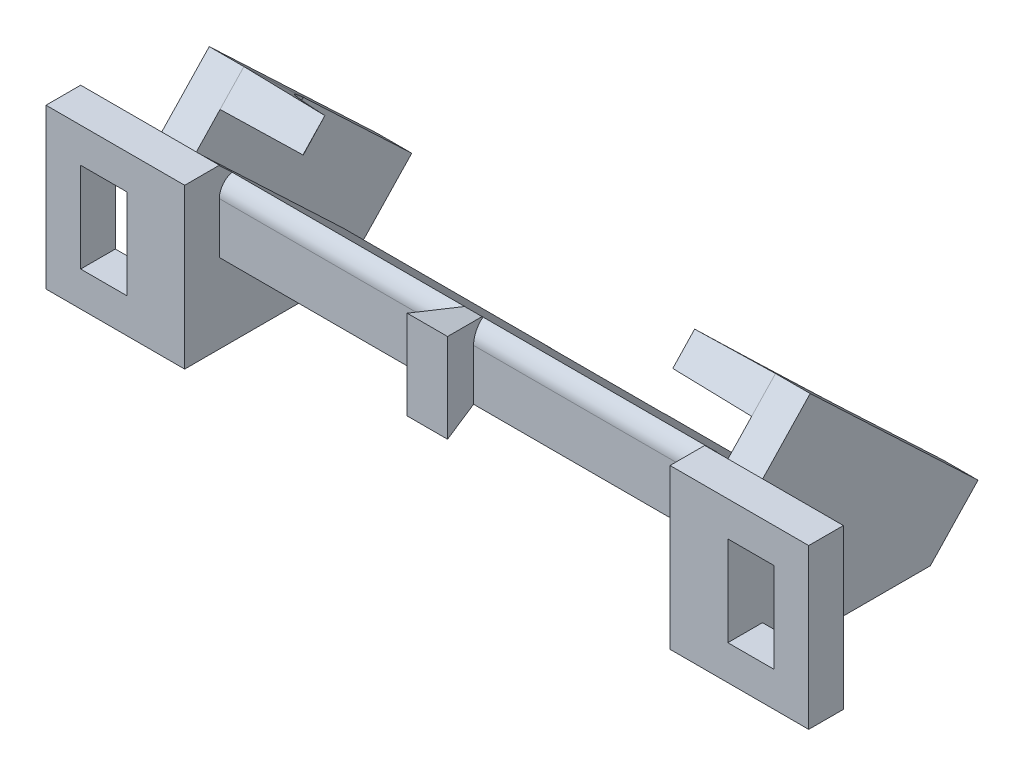
from build123d import *

# Parameters (mm, degrees)
BOSS_EXTRUDE2_DEPTH     = 26
SHELL3_T                = -5
SKETCH2_W               = 3
SKETCH2_H               = 20
BOSS_EXTRUDE3_DEPTH     = 6
BOSS_EXTRUDE4_DEPTH     = 7
BOSS_EXTRUDE4_TAPER     = 1
BOSS_EXTRUDE5_START     = -7.07
BOSS_EXTRUDE5_OUTLINE_W = 12
BOSS_EXTRUDE5_OUTLINE_H = 3
BOSS_EXTRUDE5_DEPTH     = 13.778752476
SKETCH7_W               = 4
SKETCH7_H               = 7.778752476
CUT_EXTRUDE1_DEPTH      = 3
CUT_EXTRUDE5_DEPTH      = 3
SKETCH8_W               = 2
SKETCH8_H               = 6.204571956
BOSS_EXTRUDE6_DEPTH     = 3
BOSS_EXTRUDE6_DRAFT     = -14
SKETCH10_W              = 10
SKETCH10_H              = 3
CUT_EXTRUDE2_DEPTH      = 3
CHAMFER2_SIZE           = 1.5
CHAMFER2_SIZE_2         = 1.061054559
FILLET7_R               = 1.5


# Read off the part's stored shape, not the designer's step: Boss-Extrude5
with BuildPart() as part:
    # Sketch1 → Boss-Extrude2 (new, symmetric)
    with BuildSketch(Plane(origin=(0, 0, 0), x_dir=(0, 0, -1), z_dir=(1, 0, 0))):
        Polygon((-7.07, 6.681327836), (-7.07, -7.07), (7.452430332, -7.07), align=None)
    extrude(amount=BOSS_EXTRUDE2_DEPTH, both=True)

    # Shell3
    shell3_openings = [part.faces().sort_by_distance(p)[0] for p in [
        (0, -0.194336082, 7.07),
        (0, -7.07, -0.191215166),
    ]]
    offset(amount=SHELL3_T, openings=shell3_openings, kind=Kind.INTERSECTION)

    # Sketch2 → Boss-Extrude3 (add)
    with BuildSketch(Plane(origin=(0, -0.006998714, 0.006627101), x_dir=(1, 0, 0), z_dir=(0, 0.7261215165867746, -0.6875663918122543))):
        with Locations((-24.5, 0.272464405)):
            Rectangle(SKETCH2_W, SKETCH2_H)
    boss_extrude3 = extrude(amount=BOSS_EXTRUDE3_DEPTH)

    # Sketch3 → Boss-Extrude4 (add)
    with BuildSketch(Plane(origin=(-23, 0, 0), x_dir=(0, 0, -1), z_dir=(1, 0, 0))):
        Polygon((-5.007300825, 8.859692386), (0.075549792, 4.046727643), (2.138248967, 6.225092193), (-2.944601649, 11.038056936), align=None)
    boss_extrude4 = extrude(amount=BOSS_EXTRUDE4_DEPTH, taper=BOSS_EXTRUDE4_TAPER)

    # Boss-Extrude5 outline → Boss-Extrude5 (add)
    with BuildSketch(Plane(origin=(0, 0, 0), x_dir=(1, 0, 0), z_dir=(0, 1, 0)).offset(BOSS_EXTRUDE5_START)):
        with Locations((-27, -8.57)):
            Rectangle(BOSS_EXTRUDE5_OUTLINE_W, BOSS_EXTRUDE5_OUTLINE_H)
    boss_extrude5 = extrude(amount=BOSS_EXTRUDE5_DEPTH)

    # Sketch7 → Cut-Extrude1 (cut)
    with BuildSketch(Plane(origin=(0, 0, 7.07), x_dir=(-1, 0, 0), z_dir=(0, 0, -1))):
        with Locations((28, -0.180623762)):
            Rectangle(SKETCH7_W, SKETCH7_H)
    cut_extrude1 = extrude(amount=-CUT_EXTRUDE1_DEPTH, mode=Mode.SUBTRACT)

    # Sketch11 → Cut-Extrude5 (cut)
    with BuildSketch(Plane(origin=(0.097524812, 4.056980848, -3.841565936), x_dir=(0.9998476951563913, -0.012672567830329124, 0.011999688122524015), z_dir=(0.017452406437283557, 0.72601092476275, -0.6874616721204788))):
        with BuildLine():
            ThreePointArc((-16.099976916, -9.605350141), (-20.470201884, -7.075920319), (-23.038834329, -2.72862129))
            add(Edge.make_bspline(
                [(-23.038834329, -2.72862129), (-20.964785252, -1.12213519), (-16.845095332, -0.866613762), (-13.311050846, -5.432002143), (-14.677947992, -8.654526842), (-16.099976916, -9.605350141)],
                knots=[0, 0, 0, 0, 0.462245197, 0.666716807, 1, 1, 1, 1], degree=3))
        make_face()
    cut_extrude5 = extrude(amount=-CUT_EXTRUDE5_DEPTH, mode=Mode.SUBTRACT)

    # Mirror4: Boss-Extrude3, Boss-Extrude4, Boss-Extrude5, Cut-Extrude1, Cut-Extrude5 across plane
    add(boss_extrude3.mirror(Plane(origin=(0, 0, 0), x_dir=(0, 0, 1), z_dir=(1, 0, 0))))
    add(boss_extrude4.mirror(Plane(origin=(0, 0, 0), x_dir=(0, 0, 1), z_dir=(1, 0, 0))))
    add(boss_extrude5.mirror(Plane(origin=(0, 0, 0), x_dir=(0, 0, 1), z_dir=(1, 0, 0))))
    add(cut_extrude1.mirror(Plane(origin=(0, 0, 0), x_dir=(0, 0, 1), z_dir=(1, 0, 0))), mode=Mode.SUBTRACT)
    add(cut_extrude5.mirror(Plane(origin=(0, 0, 0), x_dir=(0, 0, 1), z_dir=(1, 0, 0))), mode=Mode.SUBTRACT)


with BuildPart() as boss_extrude6_tool:
    # Sketch8 → Boss-Extrude6 (with draft: the straight prism first)
    with BuildSketch(Plane.XY.offset(7.07)):
        with Locations((0, 2.897714022)):
            Rectangle(SKETCH8_W, SKETCH8_H)
    extrude(amount=BOSS_EXTRUDE6_DEPTH)
    # Boss-Extrude6: the draft: its side faces are tilted about the plane it starts from
    boss_extrude6_sides = [boss_extrude6_tool.faces().sort_by_distance(p)[0] for p in [
        (0, -0.204571956, 8.57),
        (1, 2.897714022, 8.57),
        (0, 6, 8.57),
        (-1, 2.897714022, 8.57),
    ]]
    draft(boss_extrude6_sides, Plane.XY.offset(7.07), BOSS_EXTRUDE6_DRAFT)


with BuildPart() as part_1:
    add(part.part)

    # Boss-Extrude6: add boss_extrude6_tool
    add(boss_extrude6_tool.part)

    # Sketch10 → Cut-Extrude2 (cut)
    with BuildSketch(Plane(origin=(0, -0.006998714, 0.006627101), x_dir=(1, 0, 0), z_dir=(0, 0.7261215165867746, -0.6875663918122543))):
        with Locations((0, 8.772464405)):
            Rectangle(SKETCH10_W, SKETCH10_H)
    extrude(amount=-CUT_EXTRUDE2_DEPTH, mode=Mode.SUBTRACT)

    # Chamfer2
    # the kernel refuses this chamfer: 1.5, 1.061054559 mm, written as the material it takes off along each edge
    with BuildSketch(Plane(origin=(21, 6.681327836, 7.07), x_dir=(0, -0.6673410869627874, -0.7447522229918655), z_dir=(-1, 0, 0))) as chamfer2_piece_1_section:
        Polygon((CHAMFER2_SIZE * 0.999621916911, CHAMFER2_SIZE * 0.0274958766106), (CHAMFER2_SIZE_2 * 0.667341086869, CHAMFER2_SIZE_2 * 0.744752222888), (0, 0), align=None)
    chamfer2_piece_1 = extrude(amount=45.857524482, mode=Mode.PRIVATE)
    chamfer2_piece_1 = split(chamfer2_piece_1, bisect_by=Plane(origin=(1.484835195, 5.763736447, 9.014567757), z_dir=(0.9702957262759965, 0, -0.24192189559966784)), keep=Keep.TOP, mode=Mode.PRIVATE)
    add(chamfer2_piece_1, mode=Mode.SUBTRACT)
    with BuildSketch(Plane(origin=(24.857524482, 6.681327836, 7.07), x_dir=(0, -0.6673410869627874, -0.7447522229918655), z_dir=(-1, 0, 0))) as chamfer2_piece_2_section:
        Polygon((CHAMFER2_SIZE * 0.999621916911, CHAMFER2_SIZE * 0.0274958766106), (CHAMFER2_SIZE_2 * 0.667341086869, CHAMFER2_SIZE_2 * 0.744752222888), (0, 0), align=None)
    chamfer2_piece_2 = extrude(amount=45.857524482, mode=Mode.PRIVATE)
    chamfer2_piece_2 = split(chamfer2_piece_2, bisect_by=Plane(origin=(-1.484835195, 5.763736447, 9.014567757), z_dir=(-0.9702957262759965, 0, -0.24192189559966784)), keep=Keep.TOP, mode=Mode.PRIVATE)
    add(chamfer2_piece_2, mode=Mode.SUBTRACT)
    with BuildSketch(Plane(origin=(24.857524482, 6.681327836, 7.07), x_dir=(0, -0.6673410869627874, -0.7447522229918655), z_dir=(-1, 0, 0))) as chamfer2_piece_3_section:
        Polygon((CHAMFER2_SIZE * 0.999621916911, CHAMFER2_SIZE * 0.0274958766106), (CHAMFER2_SIZE_2 * 0.667341086869, CHAMFER2_SIZE_2 * 0.744752222888), (0, 0), align=None)
    chamfer2_piece_3 = extrude(amount=49.715048964, mode=Mode.PRIVATE)
    chamfer2_piece_3 = split(chamfer2_piece_3, bisect_by=Plane(origin=(0.868426691, 6.154537231, 6.542288281), z_dir=(-0.9702957262759965, 0, 0.24192189559966784)), keep=Keep.TOP, mode=Mode.PRIVATE)
    chamfer2_piece_3 = split(chamfer2_piece_3, bisect_by=Plane(origin=(0, 5.935997372, 6.81329948), z_dir=(0, 0.9702957262759965, -0.24192189559966784)), keep=Keep.TOP, mode=Mode.PRIVATE)
    chamfer2_piece_3 = split(chamfer2_piece_3, bisect_by=Plane(origin=(-0.868426691, 6.154537231, 6.542288281), z_dir=(0.9702957262759965, 0, 0.24192189559966784)), keep=Keep.TOP, mode=Mode.PRIVATE)
    add(chamfer2_piece_3, mode=Mode.SUBTRACT)
    with BuildSketch(Plane(origin=(23, -7.07, -7.452430332), x_dir=(0, 0.7275099269437866, 0.6860971550722583), z_dir=(-1, 0, 0)), Plane(origin=(-1.142475518, -7.07, -7.452430332), x_dir=(0, 0.7275099269437866, 0.6860971550722583), z_dir=(-1, 0, 0))) as chamfer2_piece_4:
        Polygon((CHAMFER2_SIZE_2 * 0.998401282104, -CHAMFER2_SIZE_2 * 0.0565232661308), (CHAMFER2_SIZE * 0.686097155072, -CHAMFER2_SIZE * 0.727509926944), (0, 0), align=None)
    extrude(amount=21.857524482, mode=Mode.SUBTRACT)

    # Fillet7
    # the kernel refuses this fillet: 1.5 mm, written as the material it takes off along each edge
    with BuildSketch(Plane(origin=(21, 5.620273277, 7.07), x_dir=(0, 0.02726259017777431, -0.9996283065103743), z_dir=(-1, 0, 0))) as fillet7_piece_1_section:
        with BuildLine():
            CenterArc((1.460922015, 1.453310189), FILLET7_R, 181.562224917, 74.10480975)
            Line((-0.038520445, 1.412416304), (-0.068509294, 1.411598426))
            Line((-0.068509294, 1.411598426), (-0.029988849, -0.000817878))
            Line((-0.029988849, -0.000817878), (0, -0.03))
            ThreePointArc((0, -0.03), (0.544793634, -0.03), (1.082160572, -0.029066204))
            Line((1.082160572, -0.029066204), (1.089587267, 0))
        make_face()
    fillet7_piece_1 = extrude(amount=23.532353712, mode=Mode.PRIVATE)
    fillet7_piece_1 = split(fillet7_piece_1, bisect_by=Plane(origin=(1.518643203, 5.295979724, 9.15016427), z_dir=(0.9702957262759188, 0, -0.24192189559997973)), keep=Keep.TOP, mode=Mode.PRIVATE)
    add(fillet7_piece_1, mode=Mode.SUBTRACT)
    with BuildSketch(Plane(origin=(21, 5.620273277, 7.07), x_dir=(0, 0.02726259017777431, -0.9996283065103743), z_dir=(-1, 0, 0))) as fillet7_piece_2_section:
        with BuildLine():
            CenterArc((1.460922015, 1.453310189), FILLET7_R, 181.562224917, 74.10480975)
            Line((-0.038520445, 1.412416304), (-0.068509294, 1.411598426))
            Line((-0.068509294, 1.411598426), (-0.029988849, -0.000817878))
            Line((-0.029988849, -0.000817878), (0, -0.03))
            ThreePointArc((0, -0.03), (0.544793634, -0.03), (1.082160572, -0.029066204))
            Line((1.082160572, -0.029066204), (1.089587267, 0))
        make_face()
    fillet7_piece_2 = extrude(amount=23.532353712, mode=Mode.PRIVATE)
    fillet7_piece_2 = split(fillet7_piece_2, bisect_by=Plane(origin=(-0.975981109, 5.302873869, 6.97366549), z_dir=(-0.9702957262759188, 0, -0.24192189559997973)), keep=Keep.TOP, mode=Mode.PRIVATE)
    add(fillet7_piece_2, mode=Mode.SUBTRACT)
    with BuildSketch(Plane(origin=(2.532353712, 5.620273277, 7.07), x_dir=(0, 0.02726259017777401, -0.9996283065103743), z_dir=(-1, 0, 0))) as fillet7_piece_3_section:
        with BuildLine():
            CenterArc((1.460922015, 1.453310189), FILLET7_R, 181.562224917, 74.10480975)
            Line((-0.038520445, 1.412416304), (-0.068509294, 1.411598426))
            Line((-0.068509294, 1.411598426), (-0.029988849, -0.000817878))
            Line((-0.029988849, -0.000817878), (0, -0.03))
            ThreePointArc((0, -0.03), (0.544793634, -0.03), (1.082160572, -0.029066204))
            Line((1.082160572, -0.029066204), (1.089587267, 0))
        make_face()
    fillet7_piece_3 = extrude(amount=23.532353712, mode=Mode.PRIVATE)
    fillet7_piece_3 = split(fillet7_piece_3, bisect_by=Plane(origin=(0.975981109, 5.302873869, 6.97366549), z_dir=(0.9702957262759188, 0, -0.24192189559997973)), keep=Keep.TOP, mode=Mode.PRIVATE)
    add(fillet7_piece_3, mode=Mode.SUBTRACT)
    with BuildSketch(Plane(origin=(2.532353712, 5.620273277, 7.07), x_dir=(0, 0.02726259017777401, -0.9996283065103743), z_dir=(-1, 0, 0))) as fillet7_piece_4_section:
        with BuildLine():
            CenterArc((1.460922015, 1.453310189), FILLET7_R, 181.562224917, 74.10480975)
            Line((-0.038520445, 1.412416304), (-0.068509294, 1.411598426))
            Line((-0.068509294, 1.411598426), (-0.029988849, -0.000817878))
            Line((-0.029988849, -0.000817878), (0, -0.03))
            ThreePointArc((0, -0.03), (0.544793634, -0.03), (1.082160572, -0.029066204))
            Line((1.082160572, -0.029066204), (1.089587267, 0))
        make_face()
    fillet7_piece_4 = extrude(amount=23.532353712, mode=Mode.PRIVATE)
    fillet7_piece_4 = split(fillet7_piece_4, bisect_by=Plane(origin=(-1.518643203, 5.295979724, 9.15016427), z_dir=(-0.9702957262759188, 0, -0.24192189559997973)), keep=Keep.TOP, mode=Mode.PRIVATE)
    add(fillet7_piece_4, mode=Mode.SUBTRACT)
    with BuildSketch(Plane(origin=(-21, -7.07, -0.180405318), x_dir=(0, 0, -1), z_dir=(1, 0, 0))) as fillet7_piece_5:
        with BuildLine():
            CenterArc((FILLET7_R * 0.398330236432, FILLET7_R), FILLET7_R, 226.562224917, 43.437775083)
            Line((-FILLET7_R * 0.28923615538, FILLET7_R * 0.273878483413), (-FILLET7_R * 0.302987483217, FILLET7_R * 0.259356053081))
            Line((-FILLET7_R * 0.302987483217, FILLET7_R * 0.259356053081), (-FILLET7_R * 0.00796660472864, -FILLET7_R * 0.02))
            Line((-FILLET7_R * 0.00796660472864, -FILLET7_R * 0.02), (FILLET7_R * 0.398330236432, -FILLET7_R * 0.02))
            Line((FILLET7_R * 0.398330236432, -FILLET7_R * 0.02), (FILLET7_R * 0.398330236432, 0))
        make_face()
    extrude(amount=42, mode=Mode.SUBTRACT)
    with BuildSketch(Plane(origin=(23, -6.340454545, -6.681975786), x_dir=(0, 0.6875663918122538, 0.7261215165867753), z_dir=(-1, 0, 0)), Plane(origin=(-1.367407216, -6.340454545, -6.681975786), x_dir=(0, 0.6875663918122543, 0.7261215165867746), z_dir=(-1, 0, 0))) as fillet7_piece_6:
        with BuildLine():
            CenterArc((1.453037114, -1.5), FILLET7_R, 90, 71.794047616)
            Line((0.028127716, -1.031349588), (-0.000370472, -1.021976579))
            ThreePointArc((-0.000370472, -1.021976579), (-0.015924991, -0.516492672), (-0.029988849, -0.000817878))
            Line((-0.029988849, -0.000817878), (0, 0.03))
            Line((0, 0.03), (1.453037114, 0.03))
            Line((1.453037114, 0.03), (1.453037114, 0))
        make_face()
    extrude(amount=21.632592784, mode=Mode.SUBTRACT)


solid = part_1.part
